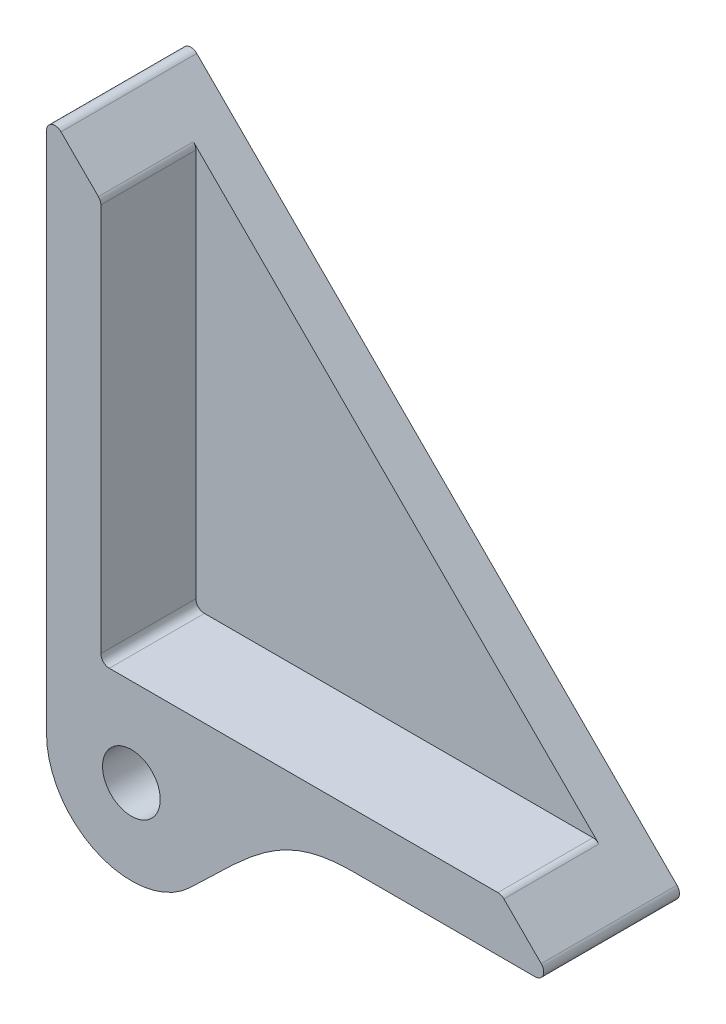
from build123d import *

# Parameters (mm, degrees)
SKETCH1_R           = 1.7
BOSS_EXTRUDE1_DEPTH = 8
CUT_EXTRUDE1_DEPTH  = 5.6
FILLET1_R           = 0.5
SKETCH5_R           = 3.7
CUT_EXTRUDE2_DEPTH  = 1
CHAMFER1_SIZE       = 2
SKETCH6_R           = 1.7
BOSS_EXTRUDE2_DEPTH = 0.4
BOSS_EXTRUDE3_START = -0.4
SKETCH7_R           = 3.7
BOSS_EXTRUDE3_DEPTH = 0.4


with BuildPart() as part:
    # Sketch1 → Boss-Extrude1 (new body)
    with BuildSketch(Plane.XY):
        with BuildLine():
            Line((0, 0), (0, 30))
            Line((0, 30), (30, 0))
            Line((30, 0), (18, 0))
            add(Edge.make_bspline(
                [(18, 0), (13.851240238, 0), (12.090763012, -2.133887147), (8.457514689, -5.611868239)],
                knots=[0, 0, 0, 0, 1, 1, 1, 1], degree=3))
            ThreePointArc((8.457514689, -5.611868239), (3.036275661, -6.598237349), (0, -2))
            Line((0, -2), (0, 0))
        make_face()
        with Locations((5, -2)):
            Circle(SKETCH1_R, mode=Mode.SUBTRACT)
    extrude(amount=BOSS_EXTRUDE1_DEPTH)

    # Sketch2 → Cut-Extrude1 (cut)
    with BuildSketch(Plane.XY.offset(8)):
        Polygon((3.2, 26.8), (3.2, 3.2), (26.8, 3.2), align=None)
    extrude(amount=-CUT_EXTRUDE1_DEPTH, mode=Mode.SUBTRACT)

    # Fillet1
    fillet1_edges = [part.edges().sort_by_distance(p)[0] for p in [
        (0, 30, 4),
        (30, 0, 4),
        (3.2, 26.8, 5.2),
        (26.8, 3.2, 5.2),
        (3.2, 3.2, 5.2),
    ]]
    fillet(fillet1_edges, radius=FILLET1_R)

    # Sketch5 → Cut-Extrude2 (cut)
    with BuildSketch(Plane(origin=(0, 0, 0), x_dir=(-1, 0, 0), z_dir=(0, 0, -1))):
        with Locations((-5, -2)):
            Circle(SKETCH5_R)
    extrude(amount=-CUT_EXTRUDE2_DEPTH, mode=Mode.SUBTRACT)

    # Chamfer1
    chamfer1_edges = [part.edges().sort_by_distance(p)[0] for p in [
        (3.3, -2, 1),
    ]]
    chamfer(chamfer1_edges, length=CHAMFER1_SIZE - 0.0001)  # a hair under: the kernel refuses the full size

    # Sketch6 → Boss-Extrude2 (add)
    with BuildSketch(Plane.XY.offset(3)):
        with Locations((5, -2)):
            Circle(SKETCH6_R)
    extrude(amount=BOSS_EXTRUDE2_DEPTH)

    # Sketch7 → Boss-Extrude3 (add)
    with BuildSketch(Plane.XY.offset(1).offset(BOSS_EXTRUDE3_START)):
        with Locations(Location((5, -2, 0), (0, 0, 180))):
            Circle(SKETCH7_R)
    extrude(amount=BOSS_EXTRUDE3_DEPTH)


solid = part.part
